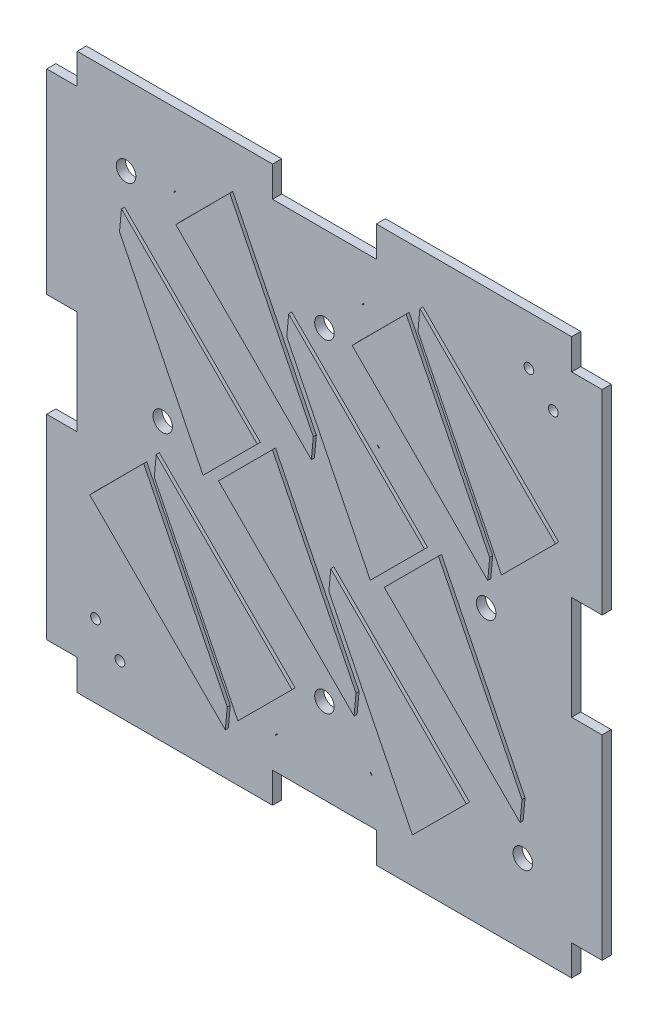
from build123d import *

# Parameters (mm, degrees)
BOSS_EXTRUDE1_OUTLINE_R     = 0.8
BOSS_EXTRUDE1_OUTLINE_R_2   = 1.6
BOSS_EXTRUDE1_DEPTH         = 1.5
BOSS_EXTRUDE6_DEPTH         = 0.01
BOSS_EXTRUDE6_DEPTH_BACK    = 2
BOSS_EXTRUDE6_2_DEPTH       = 0.01
BOSS_EXTRUDE6_2_DEPTH_BACK  = 2
BOSS_EXTRUDE6_3_DEPTH       = 0.01
BOSS_EXTRUDE6_3_DEPTH_BACK  = 2
BOSS_EXTRUDE6_4_DEPTH       = 0.01
BOSS_EXTRUDE6_4_DEPTH_BACK  = 2
BOSS_EXTRUDE6_5_DEPTH       = 0.01
BOSS_EXTRUDE6_5_DEPTH_BACK  = 2
BOSS_EXTRUDE6_6_DEPTH       = 0.01
BOSS_EXTRUDE6_6_DEPTH_BACK  = 2
BOSS_EXTRUDE6_7_DEPTH       = 0.01
BOSS_EXTRUDE6_7_DEPTH_BACK  = 2
BOSS_EXTRUDE6_8_DEPTH       = 0.01
BOSS_EXTRUDE6_8_DEPTH_BACK  = 2
BOSS_EXTRUDE6_9_DEPTH       = 0.01
BOSS_EXTRUDE6_9_DEPTH_BACK  = 2
BOSS_EXTRUDE6_10_DEPTH      = 0.01
BOSS_EXTRUDE6_10_DEPTH_BACK = 2


# Read off the part's stored shape, not the designer's step: Boss-Extrude1
with BuildPart() as part:
    # Boss-Extrude1 outline → Boss-Extrude1 (new body)
    with BuildSketch(Plane.XY):
        Polygon((32, 86), (0, 86), (0, 81), (-5, 81), (-5, 49), (0, 49), (0, 32), (-5, 32), (-5, 0), (0, 0), (0, -5), (32, -5), (32, 0), (49, 0), (49, -5), (81, -5), (81, 0), (86, 0), (86, 32), (81, 32), (81, 49), (86, 49), (86, 81), (81, 81), (81, 86), (49, 86), (49, 81), (32, 81), align=None)
        with Locations((7, 3)):
            Circle(BOSS_EXTRUDE1_OUTLINE_R, mode=Mode.SUBTRACT)
        with Locations((3, 7)):
            Circle(BOSS_EXTRUDE1_OUTLINE_R, mode=Mode.SUBTRACT)
        Polygon((32.8121, 5.4565), (32.5293, 5.1737), (32.4586, 5.2444), (32.7414, 5.5272), align=None, mode=Mode.SUBTRACT)
        with BuildLine():
            ThreePointArc((2.545502959, 24.574484636), (2.522251411, 24.57119913), (2.503101965, 24.58479059))
            ThreePointArc((2.503101965, 24.58479059), (2.515532789, 24.610246237), (2.54334286, 24.615642096))
            Line((2.54334286, 24.615642096), (11.385, 33.4568))
            Line((11.385, 33.4568), (25.0723, 5.7471))
            Line((25.0723, 5.7471), (24.7588, 2.3352))
            Line((24.7588, 2.3352), (2.545502959, 24.574484636))
        make_face(mode=Mode.SUBTRACT)
        with BuildLine():
            ThreePointArc((35.654497041, 13.525515364), (35.677715734, 13.528808837), (35.696861218, 13.515266122))
            ThreePointArc((35.696861218, 13.515266122), (35.684479687, 13.489758091), (35.656646521, 13.484347286))
            Line((35.656646521, 13.484347286), (26.815, 4.6432))
            Line((26.815, 4.6432), (13.1277, 32.3529))
            Line((13.1277, 32.3529), (13.4412, 35.7648))
            Line((13.4412, 35.7648), (35.654497041, 13.525515364))
        make_face(mode=Mode.SUBTRACT)
        with BuildLine():
            ThreePointArc((23.645502959, 37.074484636), (23.622251411, 37.07119913), (23.603101965, 37.08479059))
            ThreePointArc((23.603101965, 37.08479059), (23.615532789, 37.110246237), (23.64334286, 37.115642096))
            Line((23.64334286, 37.115642096), (32.485, 45.9568))
            Line((32.485, 45.9568), (46.1723, 18.2471))
            Line((46.1723, 18.2471), (45.8588, 14.8352))
            Line((45.8588, 14.8352), (23.645502959, 37.074484636))
        make_face(mode=Mode.SUBTRACT)
        Polygon((48.2565, 7.3879), (47.9737, 7.6707), (48.0444, 7.7414), (48.3272, 7.4586), align=None, mode=Mode.SUBTRACT)
        with Locations((40.5, 14)):
            Circle(BOSS_EXTRUDE1_OUTLINE_R_2, mode=Mode.SUBTRACT)
        with Locations((73, 8)):
            Circle(BOSS_EXTRUDE1_OUTLINE_R_2, mode=Mode.SUBTRACT)
        with BuildLine():
            ThreePointArc((64.254497041, 11.625515364), (64.277715734, 11.628808837), (64.296861218, 11.615266122))
            ThreePointArc((64.296861218, 11.615266122), (64.284479687, 11.589758091), (64.256646521, 11.584347286))
            Line((64.256646521, 11.584347286), (55.415, 2.7432))
            Line((55.415, 2.7432), (41.7277, 30.4529))
            Line((41.7277, 30.4529), (42.0412, 33.8648))
            Line((42.0412, 33.8648), (64.254497041, 11.625515364))
        make_face(mode=Mode.SUBTRACT)
        with BuildLine():
            ThreePointArc((50.845502959, 35.574484636), (50.822251411, 35.57119913), (50.803101965, 35.58479059))
            ThreePointArc((50.803101965, 35.58479059), (50.815532789, 35.610246237), (50.84334286, 35.615642096))
            Line((50.84334286, 35.615642096), (59.685, 44.4568))
            Line((59.685, 44.4568), (73.3723, 16.7471))
            Line((73.3723, 16.7471), (73.0588, 13.3352))
            Line((73.0588, 13.3352), (50.845502959, 35.574484636))
        make_face(mode=Mode.SUBTRACT)
        with Locations((14, 40.5)):
            Circle(BOSS_EXTRUDE1_OUTLINE_R_2, mode=Mode.SUBTRACT)
        with BuildLine():
            ThreePointArc((29.954497041, 45.525515364), (29.977670775, 45.528819679), (29.996810657, 45.515343577))
            ThreePointArc((29.996810657, 45.515343577), (29.984476737, 45.489794133), (29.956635847, 45.484336613))
            Line((29.956635847, 45.484336613), (21.115, 36.6432))
            Line((21.115, 36.6432), (7.4277, 64.3529))
            Line((7.4277, 64.3529), (7.7412, 67.7648))
            Line((7.7412, 67.7648), (29.954497041, 45.525515364))
        make_face(mode=Mode.SUBTRACT)
        with Locations((8, 73)):
            Circle(BOSS_EXTRUDE1_OUTLINE_R_2, mode=Mode.SUBTRACT)
        Polygon((15.7879, 73.9435), (16.0707, 74.2263), (16.1414, 74.1556), (15.8586, 73.8728), align=None, mode=Mode.SUBTRACT)
        with BuildLine():
            ThreePointArc((16.645502959, 69.974484636), (16.622251411, 69.97119913), (16.603101965, 69.98479059))
            ThreePointArc((16.603101965, 69.98479059), (16.615532789, 70.010246237), (16.64334286, 70.015642096))
            Line((16.64334286, 70.015642096), (25.485, 78.8568))
            Line((25.485, 78.8568), (39.1723, 51.1471))
            Line((39.1723, 51.1471), (38.8588, 47.7352))
            Line((38.8588, 47.7352), (16.645502959, 69.974484636))
        make_face(mode=Mode.SUBTRACT)
        with BuildLine():
            ThreePointArc((57.354497041, 44.325515364), (57.377716122, 44.328808743), (57.396861653, 44.315265453))
            ThreePointArc((57.396861653, 44.315265453), (57.384479701, 44.289757901), (57.356646713, 44.284347478))
            Line((57.356646713, 44.284347478), (48.515, 35.4432))
            Line((48.515, 35.4432), (34.8277, 63.1529))
            Line((34.8277, 63.1529), (35.1412, 66.5648))
            Line((35.1412, 66.5648), (57.354497041, 44.325515364))
        make_face(mode=Mode.SUBTRACT)
        Polygon((49.4565, 54.3879), (49.1737, 54.6707), (49.2444, 54.7414), (49.5272, 54.4586), align=None, mode=Mode.SUBTRACT)
        with BuildLine():
            ThreePointArc((45.545502959, 67.274484636), (45.522251411, 67.27119913), (45.503101965, 67.28479059))
            ThreePointArc((45.503101965, 67.28479059), (45.515532789, 67.310246237), (45.54334286, 67.315642096))
            Line((45.54334286, 67.315642096), (54.385, 76.1568))
            Line((54.385, 76.1568), (68.0723, 48.4471))
            Line((68.0723, 48.4471), (67.7588, 45.0352))
            Line((67.7588, 45.0352), (45.545502959, 67.274484636))
        make_face(mode=Mode.SUBTRACT)
        with Locations((67, 40.5)):
            Circle(BOSS_EXTRUDE1_OUTLINE_R_2, mode=Mode.SUBTRACT)
        with BuildLine():
            ThreePointArc((78.854497041, 55.825515364), (78.877716122, 55.828808743), (78.896861653, 55.815265453))
            ThreePointArc((78.896861653, 55.815265453), (78.884479701, 55.789757901), (78.856646713, 55.784347478))
            Line((78.856646713, 55.784347478), (70.015, 46.9432))
            Line((70.015, 46.9432), (56.3277, 74.6529))
            Line((56.3277, 74.6529), (56.6412, 78.0648))
            Line((56.6412, 78.0648), (78.854497041, 55.825515364))
        make_face(mode=Mode.SUBTRACT)
        with Locations((40.5, 67)):
            Circle(BOSS_EXTRUDE1_OUTLINE_R_2, mode=Mode.SUBTRACT)
        Polygon((46.6879, 73.4435), (46.9707, 73.7263), (47.0414, 73.6556), (46.7586, 73.3728), align=None, mode=Mode.SUBTRACT)
        with Locations((78, 74)):
            Circle(BOSS_EXTRUDE1_OUTLINE_R, mode=Mode.SUBTRACT)
        with Locations((74, 78)):
            Circle(BOSS_EXTRUDE1_OUTLINE_R, mode=Mode.SUBTRACT)
    extrude(amount=BOSS_EXTRUDE1_DEPTH)


with BuildPart() as body_2:
    # Sketch1 → Boss-Extrude6 (new, two sides: drawn at the far end of the back side and taken through both)
    with BuildSketch(Plane(origin=(0, 0, 0), x_dir=(-1, 0, 0), z_dir=(0, 0, -1)).offset(-BOSS_EXTRUDE6_DEPTH_BACK)):
        Polygon((-70.015, 46.9432), (-78.856646713, 55.784347478), (-56.6412, 78.0648), (-56.3277, 74.6529), align=None)
    extrude(amount=BOSS_EXTRUDE6_DEPTH + BOSS_EXTRUDE6_DEPTH_BACK)


with BuildPart() as body_3:
    # Sketch1 → Boss-Extrude6 2 (new, two sides: drawn at the far end of the back side and taken through both)
    with BuildSketch(Plane(origin=(0, 0, 0), x_dir=(-1, 0, 0), z_dir=(0, 0, -1)).offset(-BOSS_EXTRUDE6_2_DEPTH_BACK)):
        Polygon((-67.7588, 45.0352), (-68.0723, 48.4471), (-54.385, 76.1568), (-45.545502959, 67.274484636), align=None)
    extrude(amount=BOSS_EXTRUDE6_2_DEPTH + BOSS_EXTRUDE6_2_DEPTH_BACK)


with BuildPart() as body_4:
    # Sketch1 → Boss-Extrude6 3 (new, two sides: drawn at the far end of the back side and taken through both)
    with BuildSketch(Plane(origin=(0, 0, 0), x_dir=(-1, 0, 0), z_dir=(0, 0, -1)).offset(-BOSS_EXTRUDE6_3_DEPTH_BACK)):
        Polygon((-73.0588, 13.3352), (-73.3723, 16.7471), (-59.685, 44.4568), (-50.803101965, 35.58479059), align=None)
    extrude(amount=BOSS_EXTRUDE6_3_DEPTH + BOSS_EXTRUDE6_3_DEPTH_BACK)


with BuildPart() as body_5:
    # Sketch1 → Boss-Extrude6 4 (new, two sides: drawn at the far end of the back side and taken through both)
    with BuildSketch(Plane(origin=(0, 0, 0), x_dir=(-1, 0, 0), z_dir=(0, 0, -1)).offset(-BOSS_EXTRUDE6_4_DEPTH_BACK)):
        Polygon((-48.515, 35.4432), (-57.396861653, 44.315265453), (-35.1412, 66.5648), (-34.8277, 63.1529), align=None)
    extrude(amount=BOSS_EXTRUDE6_4_DEPTH + BOSS_EXTRUDE6_4_DEPTH_BACK)


with BuildPart() as body_6:
    # Sketch1 → Boss-Extrude6 5 (new, two sides: drawn at the far end of the back side and taken through both)
    with BuildSketch(Plane(origin=(0, 0, 0), x_dir=(-1, 0, 0), z_dir=(0, 0, -1)).offset(-BOSS_EXTRUDE6_5_DEPTH_BACK)):
        Polygon((-38.8588, 47.7352), (-16.645502959, 69.974484636), (-25.485, 78.8568), (-39.1723, 51.1471), align=None)
    extrude(amount=BOSS_EXTRUDE6_5_DEPTH + BOSS_EXTRUDE6_5_DEPTH_BACK)


with BuildPart() as body_7:
    # Sketch1 → Boss-Extrude6 6 (new, two sides: drawn at the far end of the back side and taken through both)
    with BuildSketch(Plane(origin=(0, 0, 0), x_dir=(-1, 0, 0), z_dir=(0, 0, -1)).offset(-BOSS_EXTRUDE6_6_DEPTH_BACK)):
        Polygon((-55.415, 2.7432), (-64.256646521, 11.584347286), (-42.0412, 33.8648), (-41.7277, 30.4529), align=None)
    extrude(amount=BOSS_EXTRUDE6_6_DEPTH + BOSS_EXTRUDE6_6_DEPTH_BACK)


with BuildPart() as body_8:
    # Sketch1 → Boss-Extrude6 7 (new, two sides: drawn at the far end of the back side and taken through both)
    with BuildSketch(Plane(origin=(0, 0, 0), x_dir=(-1, 0, 0), z_dir=(0, 0, -1)).offset(-BOSS_EXTRUDE6_7_DEPTH_BACK)):
        Polygon((-45.8588, 14.8352), (-23.64334286, 37.115642096), (-32.485, 45.9568), (-46.1723, 18.2471), align=None)
    extrude(amount=BOSS_EXTRUDE6_7_DEPTH + BOSS_EXTRUDE6_7_DEPTH_BACK)


with BuildPart() as body_9:
    # Sketch1 → Boss-Extrude6 8 (new, two sides: drawn at the far end of the back side and taken through both)
    with BuildSketch(Plane(origin=(0, 0, 0), x_dir=(-1, 0, 0), z_dir=(0, 0, -1)).offset(-BOSS_EXTRUDE6_8_DEPTH_BACK)):
        Polygon((-21.115, 36.6432), (-7.4277, 64.3529), (-7.7412, 67.7648), (-29.996810657, 45.515343577), align=None)
    extrude(amount=BOSS_EXTRUDE6_8_DEPTH + BOSS_EXTRUDE6_8_DEPTH_BACK)


with BuildPart() as body_10:
    # Sketch1 → Boss-Extrude6 9 (new, two sides: drawn at the far end of the back side and taken through both)
    with BuildSketch(Plane(origin=(0, 0, 0), x_dir=(-1, 0, 0), z_dir=(0, 0, -1)).offset(-BOSS_EXTRUDE6_9_DEPTH_BACK)):
        Polygon((-35.696861218, 13.515266122), (-13.4412, 35.7648), (-13.1277, 32.3529), (-26.815, 4.6432), align=None)
    extrude(amount=BOSS_EXTRUDE6_9_DEPTH + BOSS_EXTRUDE6_9_DEPTH_BACK)


with BuildPart() as body_11:
    # Sketch1 → Boss-Extrude6 10 (new, two sides: drawn at the far end of the back side and taken through both)
    with BuildSketch(Plane(origin=(0, 0, 0), x_dir=(-1, 0, 0), z_dir=(0, 0, -1)).offset(-BOSS_EXTRUDE6_10_DEPTH_BACK)):
        Polygon((-24.7588, 2.3352), (-2.545502959, 24.574484636), (-11.385, 33.4568), (-25.0723, 5.7471), align=None)
    extrude(amount=BOSS_EXTRUDE6_10_DEPTH + BOSS_EXTRUDE6_10_DEPTH_BACK)


solid = Compound([part.part, body_2.part, body_3.part, body_4.part, body_5.part, body_6.part, body_7.part, body_8.part, body_9.part, body_10.part, body_11.part])
